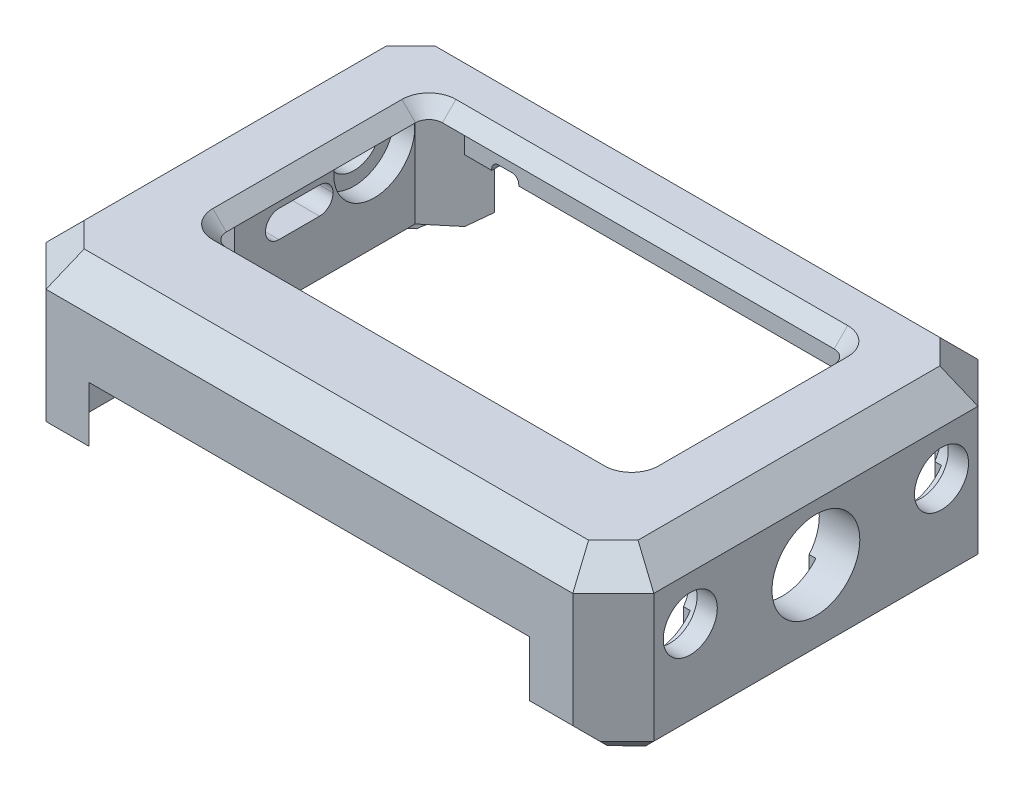
from build123d import *

# Parameters (mm, degrees)
SKETCH_1_W            = 45
SKETCH_1_H            = 30
SKETCH_1_W_2          = 39
SKETCH_1_H_2          = 28
EXTRUDE_1_DEPTH       = 7.28
SKETCH_2_W            = 45
SKETCH_2_H            = 30
SKETCH_2_W_2          = 31
SKETCH_2_H_2          = 16
EXTRUDE_2_DEPTH       = 1
CUT_EXTRUDE_1_DEPTH   = 1.4
EXTRUDE_3_DEPTH       = 4.2
EXTRUDE_4_DEPTH       = 11.48
SKETCH_5_W            = 2
SKETCH_5_H            = 1
CUT_EXTRUDE_3_DEPTH   = 0.6
CUT_EXTRUDE_5_REACH   = 50.151
SKETCH_7_R            = 2
CUT_EXTRUDE_6_REACH   = 50.151
SKETCH_8_R            = 2
CUT_EXTRUDE_4_REACH   = 50.151
SKETCH_6_R            = 3.25
CUT_EXTRUDE_7_REACH   = 50.151
SKETCH_9_W            = 5
SKETCH_9_H            = 2
CUT_EXTRUDE_8_REACH   = 50.151
SKETCH_10_W           = 12
SKETCH_10_H           = 7
SKETCH_11_R           = 3
CUT_EXTRUDE_9_DEPTH   = 1.5
CUT_EXTRUDE_START     = -1.5
SKETCH_12_R           = 3
CUT_EXTRUDE_10_DEPTH  = 1.5
FILLET_3_R            = 1
CHAMFER_2_SIZE        = 1
FILLET_6_R            = 1
FILLET_7_R            = 1
FILLET_8_R            = 0.5
CHAMFER_3_SIZE        = 0.5
CHAMFER_5_SIZE        = 0.5
SKETCH_16_W           = 5
SKETCH_16_H           = 7.19
SKETCH_16_H_2         = 6.3
CUT_EXTRUDE_11_DEPTH  = 0.5
SKETCH_17_W           = 43
SKETCH_17_H           = 28
CUT_EXTRUDE_12_DEPTH  = 1
FILLET_11_R           = 4
SKETCH_18_R           = 0.7
CUT_EXTRUDE_13_DEPTH  = 2
CHAMFER_6_SIZE        = 3
CHAMFER_7_SIZE        = 2
CHAMFER_8_SIZE        = 1
CHAMFER_START         = -15
CHAMFER_9_OUTLINE_W   = 44
CHAMFER_9_OUTLINE_H   = 23.162236636
CHAMFER_9_DEPTH       = 2.837763364
CHAMFER_START_2       = 5.222539674
CHAMFER_9_2_OUTLINE_W = 44
CHAMFER_9_2_OUTLINE_H = 2.837763364
CHAMFER_9_2_DEPTH     = 9.82469263


with BuildPart() as part:
    # 草图1 → 凸台-拉伸1 (new body)
    with BuildSketch(Plane(origin=(0, 0, 0), x_dir=(1, 0, 0), z_dir=(0, 1, 0))):
        Rectangle(SKETCH_1_W, SKETCH_1_H)
        Rectangle(SKETCH_1_W_2, SKETCH_1_H_2, mode=Mode.SUBTRACT)
    extrude(amount=EXTRUDE_1_DEPTH)

    # 草图2 → 凸台-拉伸2 (add)
    with BuildSketch(Plane(origin=(0, 7.28, 0), x_dir=(1, 0, 0), z_dir=(0, 1, 0))):
        Rectangle(SKETCH_2_W, SKETCH_2_H)
        with Locations((0, 1.35)):
            Rectangle(SKETCH_2_W_2, SKETCH_2_H_2, mode=Mode.SUBTRACT)
    extrude(amount=EXTRUDE_2_DEPTH)

    # 草图3 → 切除-拉伸1 (cut)
    with BuildSketch(Plane.XZ):
        Polygon((-17.5, 14), (-16.3, 15), (16.3, 15), (17.5, 14), align=None)
        Polygon((17.5, -14), (16.3, -15), (-16.3, -15), (-17.5, -14), align=None)
    extrude(amount=-CUT_EXTRUDE_1_DEPTH, mode=Mode.SUBTRACT)

    # 草图14 → 凸台-拉伸3 (add)
    with BuildSketch(Plane(origin=(0, 0, 0), x_dir=(-1, 0, 0), z_dir=(0, -1, 0))):
        Polygon((22.5, -15), (16.3, -15), (17.5, -14), (19.5, -14), (19.5, 14), (17.5, 14), (16.3, 15), (22.5, 15), align=None)
        Polygon((-16.3, 15), (-17.5, 14), (-19.5, 14), (-19.5, -14), (-17.5, -14), (-16.3, -15), (-22.5, -15), (-22.5, 15), align=None)
    extrude(amount=EXTRUDE_3_DEPTH)

    # 草图15 → 凸台-拉伸4 (add)
    with BuildSketch(Plane.XZ.offset(-7.28)):
        Polygon((17.5, -14), (19.5, -12.333333333), (19.5, -14), align=None)
        Polygon((-19.5, -14), (-19.5, -12.333333333), (-17.5, -14), align=None)
        Polygon((-17.5, 14), (-19.5, 12.333333333), (-19.5, 14), align=None)
        Polygon((19.5, 14), (19.5, 12.333333333), (17.5, 14), align=None)
    extrude(amount=EXTRUDE_4_DEPTH)

    # 草图5 → 切除-拉伸3 (cut)
    with BuildSketch(Plane.XZ.offset(-1.4)):
        with Locations((14.5, -14.5)):
            Rectangle(SKETCH_5_W, SKETCH_5_H)
        with Locations((-14.5, -14.5)):
            Rectangle(SKETCH_5_W, SKETCH_5_H)
    extrude(amount=-CUT_EXTRUDE_3_DEPTH, mode=Mode.SUBTRACT)

    # 草图7 → 切除-拉伸5 (cut, up to next)
    with BuildSketch(Plane(origin=(22.5, 0, 0), x_dir=(0, 0, -1), z_dir=(1, 0, 0)), mode=Mode.PRIVATE) as cut_extrude_5_sk1:
        with Locations((-9.3, 2.99)):
            Circle(SKETCH_7_R)
    cut_extrude_5_tool1 = extrude(cut_extrude_5_sk1.sketch, amount=-CUT_EXTRUDE_5_REACH, mode=Mode.PRIVATE) & part.part
    # 草图7 → 切除-拉伸5 (cut, up to next)
    with BuildSketch(Plane(origin=(22.5, 0, 0), x_dir=(0, 0, -1), z_dir=(1, 0, 0)), mode=Mode.PRIVATE) as cut_extrude_5_sk2:
        with Locations(Location((9.3, 2.99, 0), (0, 0, 180))):
            Circle(SKETCH_7_R)
    cut_extrude_5_tool2 = extrude(cut_extrude_5_sk2.sketch, amount=-CUT_EXTRUDE_5_REACH, mode=Mode.PRIVATE) & part.part
    add(cut_extrude_5_tool1.solids().sort_by_distance((22.5, 2.99, 9.3))[0], mode=Mode.SUBTRACT)
    add(cut_extrude_5_tool2.solids().sort_by_distance((22.5, 2.99, -9.3))[0], mode=Mode.SUBTRACT)

    # 草图8 → 切除-拉伸6 (cut, up to next)
    with BuildSketch(Plane.ZY.offset(22.5), mode=Mode.PRIVATE) as cut_extrude_6_sk1:
        with Locations((-9.3, 2.99)):
            Circle(SKETCH_8_R)
    cut_extrude_6_tool1 = extrude(cut_extrude_6_sk1.sketch, amount=-CUT_EXTRUDE_6_REACH, mode=Mode.PRIVATE) & part.part
    add(cut_extrude_6_tool1.solids().sort_by_distance((-22.5, 2.99, -9.3))[0], mode=Mode.SUBTRACT)

    # 草图6 → 切除-拉伸4 (cut, up to next)
    with BuildSketch(Plane(origin=(22.5, 0, 0), x_dir=(0, 0, -1), z_dir=(1, 0, 0)), mode=Mode.PRIVATE) as cut_extrude_4_sk1:
        with Locations((0, 2.1)):
            Circle(SKETCH_6_R)
    cut_extrude_4_tool1 = extrude(cut_extrude_4_sk1.sketch, amount=-CUT_EXTRUDE_4_REACH, mode=Mode.PRIVATE) & part.part
    add(cut_extrude_4_tool1.solids().sort_by_distance((22.5, 2.1, 0))[0], mode=Mode.SUBTRACT)

    # 草图9 → 切除-拉伸7 (cut, up to next)
    with BuildSketch(Plane.ZY.offset(22.5), mode=Mode.PRIVATE) as cut_extrude_7_sk1:
        with Locations((-3.75, 1.84)):
            Rectangle(SKETCH_9_W, SKETCH_9_H)
    cut_extrude_7_tool1 = extrude(cut_extrude_7_sk1.sketch, amount=-CUT_EXTRUDE_7_REACH, mode=Mode.PRIVATE) & part.part
    add(cut_extrude_7_tool1.solids().sort_by_distance((-22.5, 1.84, -3.75))[0], mode=Mode.SUBTRACT)

    # 草图10 → 切除-拉伸8 (cut, up to next)
    with BuildSketch(Plane.ZY.offset(22.5), mode=Mode.PRIVATE) as cut_extrude_8_sk1:
        with Locations((7.04, 2.59)):
            Rectangle(SKETCH_10_W, SKETCH_10_H)
    cut_extrude_8_tool1 = extrude(cut_extrude_8_sk1.sketch, amount=-CUT_EXTRUDE_8_REACH, mode=Mode.PRIVATE) & part.part
    add(cut_extrude_8_tool1.solids().sort_by_distance((-22.5, 2.59, 7.04))[0], mode=Mode.SUBTRACT)

    # 草图11 → 切除-拉伸9 (cut)
    with BuildSketch(Plane.ZY.offset(-19.5)):
        with Locations((-9.3, 2.99)):
            Circle(SKETCH_11_R)
        with Locations((9.3, 2.99)):
            Circle(SKETCH_11_R)
    extrude(amount=-CUT_EXTRUDE_9_DEPTH, mode=Mode.SUBTRACT)

    # 草图12 → 切除-拉伸10 (cut)
    with BuildSketch(Plane(origin=(-19.5, 0, 0), x_dir=(0, 0, -1), z_dir=(1, 0, 0)).offset(CUT_EXTRUDE_START)):
        with Locations(Location((9.3, 2.99, 0), (0, 0, 180))):
            Circle(SKETCH_12_R)
    extrude(amount=CUT_EXTRUDE_10_DEPTH, mode=Mode.SUBTRACT)

    # 圆角3
    fillet_3_edges = [part.edges().sort_by_distance(p)[0] for p in [
        (15.5, 7.78, -9.35),
        (-15.5, 7.78, -9.35),
        (-15.5, 7.78, 6.65),
        (15.5, 7.78, 6.65),
    ]]
    fillet(fillet_3_edges, radius=FILLET_3_R)

    # 倒角2
    chamfer_2_edges = [part.edges().sort_by_distance(p)[0] for p in [
        (0, 8.28, 6.65),
        (15.207106781, 8.28, 6.357106781),
        (-15.207106781, 8.28, 6.357106781),
        (15.5, 8.28, -1.35),
        (-15.5, 8.28, -1.35),
        (15.207106781, 8.28, -9.057106781),
        (-15.207106781, 8.28, -9.057106781),
        (0, 8.28, -9.35),
    ]]
    chamfer(chamfer_2_edges, length=CHAMFER_2_SIZE - 0.0001)  # a hair under: the kernel refuses the full size

    # 圆角6
    # the kernel refuses this fillet: 1 mm, written as the material it adds along each edge
    with BuildSketch(Plane(origin=(-22.5, 6.09, 13.04), x_dir=(0, -1, 0), z_dir=(1, 0, 0))) as fillet_6_piece_1_section:
        with BuildLine():
            CenterArc((FILLET_6_R, FILLET_6_R), FILLET_6_R, 180, 90)
            Line((0, FILLET_6_R), (0, 0))
            Line((0, 0), (FILLET_6_R, 0))
        make_face()
    fillet_6_piece_1 = extrude(amount=6.348, mode=Mode.PRIVATE)
    fillet_6_piece_1 = split(fillet_6_piece_1, bisect_by=Plane(origin=(-20.92295082, 6.09, 11.147540984), z_dir=(-0.6401843996644782, 0, 0.7682212795973774)), keep=Keep.TOP, mode=Mode.PRIVATE)
    fillet_6_piece_1 = split(fillet_6_piece_1, bisect_by=Plane(origin=(-19.5, 6.09, 13.04), z_dir=(-1, 0, 0)), keep=Keep.TOP, mode=Mode.PRIVATE)
    add(fillet_6_piece_1)
    with BuildSketch(Plane(origin=(-22.5, 6.09, 13.04), x_dir=(0, -1, 0), z_dir=(1, 0, 0))) as fillet_6_piece_2_section:
        with BuildLine():
            CenterArc((FILLET_6_R, FILLET_6_R), FILLET_6_R, 180, 90)
            Line((0, FILLET_6_R), (0, 0))
            Line((0, 0), (FILLET_6_R, 0))
        make_face()
    fillet_6_piece_2 = extrude(amount=6.348, mode=Mode.PRIVATE)
    fillet_6_piece_2 = split(fillet_6_piece_2, bisect_by=Plane(origin=(-20.92295082, 6.09, 11.147540984), z_dir=(0.6401843996644782, 0, -0.7682212795973774)), keep=Keep.TOP, mode=Mode.PRIVATE)
    fillet_6_piece_2 = split(fillet_6_piece_2, bisect_by=Plane(origin=(-19.5, 6.09, 13.04), z_dir=(-1, 0, 0)), keep=Keep.TOP, mode=Mode.PRIVATE)
    add(fillet_6_piece_2)
    with BuildSketch(Plane(origin=(-22.5, 6.09, 13.04), x_dir=(0, -1, 0), z_dir=(1, 0, 0))) as fillet_6_piece_3_section:
        with BuildLine():
            CenterArc((FILLET_6_R, FILLET_6_R), FILLET_6_R, 180, 90)
            Line((0, FILLET_6_R), (0, 0))
            Line((0, 0), (FILLET_6_R, 0))
        make_face()
    fillet_6_piece_3 = extrude(amount=6.348, mode=Mode.PRIVATE)
    fillet_6_piece_3 = split(fillet_6_piece_3, bisect_by=Plane(origin=(-20.92295082, 6.09, 11.147540984), z_dir=(-0.6401843996644782, 0, 0.7682212795973774)), keep=Keep.TOP, mode=Mode.PRIVATE)
    fillet_6_piece_3 = split(fillet_6_piece_3, bisect_by=Plane(origin=(-19.5, 6.09, 13.04), z_dir=(1, 0, 0)), keep=Keep.TOP, mode=Mode.PRIVATE)
    add(fillet_6_piece_3)
    with BuildSketch(Plane(origin=(-22.5, 6.09, 1.04), x_dir=(0, -1, 0), z_dir=(1, 0, 0))) as fillet_6_piece_4:
        with BuildLine():
            CenterArc((FILLET_6_R, -FILLET_6_R), FILLET_6_R, 90, 90)
            Line((0, -FILLET_6_R), (0, 0))
            Line((0, 0), (FILLET_6_R, 0))
        make_face()
    extrude(amount=3)
    with BuildSketch(Plane(origin=(-22.5, -0.91, 1.04), x_dir=(0, 1, 0), z_dir=(1, 0, 0))) as fillet_6_piece_5:
        with BuildLine():
            CenterArc((FILLET_6_R, FILLET_6_R), FILLET_6_R, 180, 90)
            Line((0, FILLET_6_R), (0, 0))
            Line((0, 0), (FILLET_6_R, 0))
        make_face()
    extrude(amount=3)
    with BuildSketch(Plane(origin=(-22.5, -0.91, 13.04), x_dir=(0, 0, -1), z_dir=(1, 0, 0))) as fillet_6_piece_6_section:
        with BuildLine():
            CenterArc((FILLET_6_R, FILLET_6_R), FILLET_6_R, 180, 90)
            Line((0, FILLET_6_R), (0, 0))
            Line((0, 0), (FILLET_6_R, 0))
        make_face()
    fillet_6_piece_6 = extrude(amount=6.348, mode=Mode.PRIVATE)
    fillet_6_piece_6 = split(fillet_6_piece_6, bisect_by=Plane(origin=(-20.92295082, -0.91, 11.147540984), z_dir=(-0.6401843996644782, 0, 0.7682212795973774)), keep=Keep.TOP, mode=Mode.PRIVATE)
    fillet_6_piece_6 = split(fillet_6_piece_6, bisect_by=Plane(origin=(-19.5, -0.91, 13.04), z_dir=(-1, 0, 0)), keep=Keep.TOP, mode=Mode.PRIVATE)
    add(fillet_6_piece_6)
    with BuildSketch(Plane(origin=(-22.5, -0.91, 13.04), x_dir=(0, 0, -1), z_dir=(1, 0, 0))) as fillet_6_piece_7_section:
        with BuildLine():
            CenterArc((FILLET_6_R, FILLET_6_R), FILLET_6_R, 180, 90)
            Line((0, FILLET_6_R), (0, 0))
            Line((0, 0), (FILLET_6_R, 0))
        make_face()
    fillet_6_piece_7 = extrude(amount=6.348, mode=Mode.PRIVATE)
    fillet_6_piece_7 = split(fillet_6_piece_7, bisect_by=Plane(origin=(-20.92295082, -0.91, 11.147540984), z_dir=(-0.6401843996644782, 0, 0.7682212795973774)), keep=Keep.TOP, mode=Mode.PRIVATE)
    fillet_6_piece_7 = split(fillet_6_piece_7, bisect_by=Plane(origin=(-19.5, -0.91, 13.04), z_dir=(1, 0, 0)), keep=Keep.TOP, mode=Mode.PRIVATE)
    add(fillet_6_piece_7)
    with BuildSketch(Plane(origin=(-22.5, -0.91, 13.04), x_dir=(0, 0, -1), z_dir=(1, 0, 0))) as fillet_6_piece_8_section:
        with BuildLine():
            CenterArc((FILLET_6_R, FILLET_6_R), FILLET_6_R, 180, 90)
            Line((0, FILLET_6_R), (0, 0))
            Line((0, 0), (FILLET_6_R, 0))
        make_face()
    fillet_6_piece_8 = extrude(amount=6.348, mode=Mode.PRIVATE)
    fillet_6_piece_8 = split(fillet_6_piece_8, bisect_by=Plane(origin=(-20.92295082, -0.91, 11.147540984), z_dir=(0.6401843996644782, 0, -0.7682212795973774)), keep=Keep.TOP, mode=Mode.PRIVATE)
    fillet_6_piece_8 = split(fillet_6_piece_8, bisect_by=Plane(origin=(-19.5, -0.91, 13.04), z_dir=(-1, 0, 0)), keep=Keep.TOP, mode=Mode.PRIVATE)
    add(fillet_6_piece_8)

    # 圆角7
    fillet_7_edges = [part.edges().sort_by_distance(p)[0] for p in [
        (-21, 2.84, -1.25),
        (-21, 0.84, -1.25),
        (-21, 2.84, -6.25),
        (-21, 0.84, -6.25),
    ]]
    fillet(fillet_7_edges, radius=FILLET_7_R - 0.0001)  # a hair under: the kernel refuses the full size

    # 圆角8
    fillet_8_edges = [part.edges().sort_by_distance(p)[0] for p in [
        (15.5, 2, -14.5),
        (13.5, 2, -14.5),
        (-15.5, 2, -14.5),
        (-13.5, 2, -14.5),
    ]]
    fillet(fillet_8_edges, radius=FILLET_8_R)

    # 倒角3
    chamfer_3_edges = [part.edges().sort_by_distance(p)[0] for p in [
        (0, 1.4, 15),
    ]]
    chamfer(chamfer_3_edges, length=CHAMFER_3_SIZE)

    # 倒角5
    chamfer_5_edges = [part.edges().sort_by_distance(p)[0] for p in [
        (0, 1.4, -15),
    ]]
    chamfer(chamfer_5_edges, length=CHAMFER_5_SIZE)

    # 草图16 → 切除-拉伸11 (cut)
    with BuildSketch(Plane.ZY.offset(-19.5)):
        with Locations((-9.3, -0.605)):
            Rectangle(SKETCH_16_W, SKETCH_16_H)
        with Locations((0, -1.05)):
            Rectangle(SKETCH_16_W, SKETCH_16_H_2)
        with Locations((9.3, -0.605)):
            Rectangle(SKETCH_16_W, SKETCH_16_H)
    extrude(amount=-CUT_EXTRUDE_11_DEPTH, mode=Mode.SUBTRACT)

    # 草图17 → 切除-拉伸12 (cut)
    with BuildSketch(Plane(origin=(0, -4.2, 0), x_dir=(-1, 0, 0), z_dir=(0, -1, 0))):
        Rectangle(SKETCH_17_W, SKETCH_17_H)
    extrude(amount=-CUT_EXTRUDE_12_DEPTH, mode=Mode.SUBTRACT)

    # 圆角11
    fillet_11_edges = [part.edges().sort_by_distance(p)[0] for p in [
        (-21.5, -3.7, -14),
        (-21.5, -3.7, 14),
        (21.5, -3.7, 14),
        (21.5, -3.7, -14),
    ]]
    fillet(fillet_11_edges, radius=FILLET_11_R - 0.0001)  # a hair under: the kernel refuses the full size

    # 草图18 → 切除-拉伸13 (cut)
    with BuildSketch(Plane.XZ.offset(3.2)):
        with Locations(Location((20.5, -4.65, 0), (0, 0, 270))):
            Circle(SKETCH_18_R)
        with Locations(Location((20.5, 4.65, 0), (0, 0, 90))):
            Circle(SKETCH_18_R)
        with Locations(Location((-20.5, 4.65, 0), (0, 0, 270))):
            Circle(SKETCH_18_R)
        with Locations(Location((-20.5, -4.65, 0), (0, 0, 90))):
            Circle(SKETCH_18_R)
    extrude(amount=-CUT_EXTRUDE_13_DEPTH, mode=Mode.SUBTRACT)

    # 倒角6
    # the kernel refuses this chamfer: 3 mm, written as the material it takes off along each edge
    with BuildSketch(Plane(origin=(-22.5, -11.915048964, 15), x_dir=(0, 0, -1), z_dir=(0, 1, 0)), Plane(origin=(22.5, 15.995048964, -15), x_dir=(-1, 0, 0), z_dir=(0, -1, 0)), Plane(origin=(-22.5, -11.915048964, -15), x_dir=(1, 0, 0), z_dir=(0, 1, 0))) as chamfer_6_piece_1:
        Polygon((CHAMFER_6_SIZE, 0), (0, -CHAMFER_6_SIZE), (0, 0), align=None)
    extrude(amount=27.910097928, mode=Mode.SUBTRACT)
    with BuildSketch(Plane(origin=(22.5, 15.995048964, 15), x_dir=(-1, 0, 0), z_dir=(0, -1, 0))) as chamfer_6_piece_2:
        Polygon((CHAMFER_6_SIZE, 0), (0, CHAMFER_6_SIZE), (0, 0), align=None)
    extrude(amount=27.910097928, mode=Mode.SUBTRACT)

    # 倒角7
    chamfer_7_edges = [part.edges().sort_by_distance(p)[0] for p in [
        (0, 8.28, 15),
        (-22.5, 8.28, 0),
        (22.5, 8.28, 0),
        (0, 8.28, -15),
        (-21, 8.28, -13.5),
        (21, 8.28, -13.5),
        (21, 8.28, 13.5),
        (-21, 8.28, 13.5),
    ]]
    chamfer(chamfer_7_edges, length=CHAMFER_7_SIZE)

    # 倒角8
    # the kernel refuses this chamfer: 1 mm, written as the material it takes off along each edge
    with BuildSketch(Plane(origin=(-22.5, -4.2, -14.571682988), x_dir=(1, 0, 0), z_dir=(0, 0, 1)), Plane(origin=(22.5, -4.2, 14.571682988), x_dir=(-1, 0, 0), z_dir=(0, 0, -1))) as chamfer_8_piece_1:
        Polygon((CHAMFER_8_SIZE, 0), (0, CHAMFER_8_SIZE), (0, 0), align=None)
    extrude(amount=29.143365976, mode=Mode.SUBTRACT)
    with BuildSketch(Plane(origin=(-24.31845448, -4.2, -10.18154552), x_dir=(0.7071067811865476, 0, 0.7071067811865476), z_dir=(0.7071067811865476, 0, -0.7071067811865476)), Plane(origin=(17.68154552, -4.2, -16.81845448), x_dir=(-0.7071067811865476, 0, 0.7071067811865476), z_dir=(0.7071067811865476, 0, 0.7071067811865476)), Plane(origin=(17.68154552, -4.2, 16.81845448), x_dir=(0, 1, 0), z_dir=(0.7071067811865476, 0, -0.7071067811865476))) as chamfer_8_piece_2:
        Polygon((CHAMFER_8_SIZE, 0), (0, -CHAMFER_8_SIZE), (0, 0), align=None)
    extrude(amount=9.386006663, mode=Mode.SUBTRACT)
    with BuildSketch(Plane(origin=(-17.68154552, -4.2, 16.81845448), x_dir=(0, 1, 0), z_dir=(-0.7071067811865476, 0, -0.7071067811865476))) as chamfer_8_piece_3:
        Polygon((CHAMFER_8_SIZE, 0), (0, CHAMFER_8_SIZE), (0, 0), align=None)
    extrude(amount=9.386006663, mode=Mode.SUBTRACT)

    # 倒角9: read off the stored shape, not the designer's step
    # 倒角9 outline → 倒角9 (cut)
    with BuildSketch(Plane(origin=(0, 0, 0), x_dir=(1, 0, 0), z_dir=(0, 0.7071067811865511, 0.7071067811865441)).offset(CHAMFER_START)):
        with Locations((0, -0.581118318)):
            Rectangle(CHAMFER_9_OUTLINE_W, CHAMFER_9_OUTLINE_H)
    extrude(amount=CHAMFER_9_DEPTH, mode=Mode.SUBTRACT)

    # Chamfer 9 2 outline → Chamfer 9 2 (cut)
    with BuildSketch(Plane(origin=(0, 0, 0), x_dir=(1, 0, 0), z_dir=(0, 0.7071067811865511, 0.7071067811865441)).offset(CHAMFER_START_2)):
        with Locations((0, -13.581118318)):
            Rectangle(CHAMFER_9_2_OUTLINE_W, CHAMFER_9_2_OUTLINE_H)
    extrude(amount=CHAMFER_9_2_DEPTH, mode=Mode.SUBTRACT)


solid = part.part
